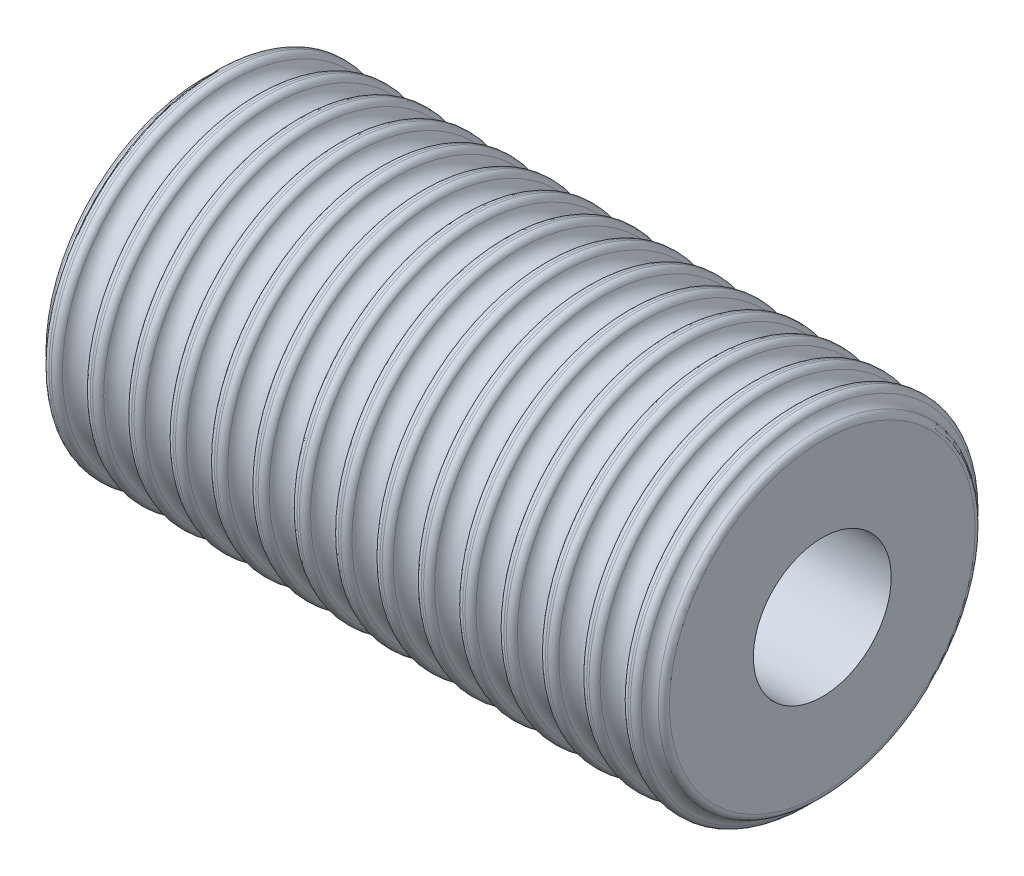
from build123d import *
from build123d.topology import SkipClean

# Parameters (mm, degrees)
SKETCH1_R           = 12.5
SKETCH1_R_2         = 5
BOSS_EXTRUDE1_DEPTH = 22.5
SKETCH11_R          = 1
SKETCH11_5_R        = 1
LPATTERN2_COUNT     = 16
LPATTERN2_PITCH     = 3
FILLET2_R           = 0.5


# Read off the part's stored shape, not the designer's step: LPattern1
with BuildPart() as part:
    # Sketch1 → Boss-Extrude1 (new, symmetric)
    with BuildSketch(Plane.YZ):
        with Locations(Location((0, 0, 0), (0, 0, 90))):
            Circle(SKETCH1_R)
        with Locations(Location((0, 0, 0), (0, 0, 90))):
            Circle(SKETCH1_R_2, mode=Mode.SUBTRACT)
    extrude(amount=BOSS_EXTRUDE1_DEPTH, both=True)

    # Sketch11 → Cut-Revolve1 (revolve, cut)
    with BuildSketch(Plane(origin=(0, 0, 0), x_dir=(-1, 0, 0), z_dir=(0, 1, 0))):
        with Locations((-22.5, 12.5)):
            Circle(SKETCH11_R)
    revolve(axis=Axis((25.114184058, 0, 0), (-1, 0, 0)), mode=Mode.SUBTRACT)

    # LPattern1 outline → LPattern1 (revolve, cut)
    with BuildSketch(Plane.YX):
        with BuildLine():
            Line((12.5, 19.5), (11.5, 19.5))
            ThreePointArc((11.5, 19.5), (11.792893219, 18.792893219), (12.5, 18.5))
            Line((12.5, 18.5), (12.5, 19.5))
        make_face()
        with BuildLine():
            Line((12.5, 15.5), (12.5, 16.5))
            Line((12.5, 16.5), (11.5, 16.5))
            ThreePointArc((11.5, 16.5), (11.792893219, 15.792893219), (12.5, 15.5))
        make_face()
        with BuildLine():
            Line((12.5, 12.5), (12.5, 13.5))
            Line((12.5, 13.5), (11.5, 13.5))
            ThreePointArc((11.5, 13.5), (11.792893219, 12.792893219), (12.5, 12.5))
        make_face()
        with BuildLine():
            Line((12.5, 9.5), (12.5, 10.5))
            Line((12.5, 10.5), (11.5, 10.5))
            ThreePointArc((11.5, 10.5), (11.792893219, 9.792893219), (12.5, 9.5))
        make_face()
        with BuildLine():
            Line((12.5, 6.5), (12.5, 7.5))
            Line((12.5, 7.5), (11.5, 7.5))
            ThreePointArc((11.5, 7.5), (11.792893219, 6.792893219), (12.5, 6.5))
        make_face()
        with BuildLine():
            Line((12.5, 3.5), (12.5, 4.5))
            Line((12.5, 4.5), (11.5, 4.5))
            ThreePointArc((11.5, 4.5), (11.792893219, 3.792893219), (12.5, 3.5))
        make_face()
        with BuildLine():
            Line((12.5, 0.5), (12.5, 1.5))
            Line((12.5, 1.5), (11.5, 1.5))
            ThreePointArc((11.5, 1.5), (11.792893219, 0.792893219), (12.5, 0.5))
        make_face()
        with BuildLine():
            Line((12.5, -2.5), (12.5, -1.5))
            Line((12.5, -1.5), (11.5, -1.5))
            ThreePointArc((11.5, -1.5), (11.792893219, -2.207106781), (12.5, -2.5))
        make_face()
        with BuildLine():
            Line((12.5, -5.5), (12.5, -4.5))
            Line((12.5, -4.5), (11.5, -4.5))
            ThreePointArc((11.5, -4.5), (11.792893219, -5.207106781), (12.5, -5.5))
        make_face()
        with BuildLine():
            Line((12.5, -8.5), (12.5, -7.5))
            Line((12.5, -7.5), (11.5, -7.5))
            ThreePointArc((11.5, -7.5), (11.792893219, -8.207106781), (12.5, -8.5))
        make_face()
        with BuildLine():
            Line((12.5, -11.5), (12.5, -10.5))
            Line((12.5, -10.5), (11.5, -10.5))
            ThreePointArc((11.5, -10.5), (11.792893219, -11.207106781), (12.5, -11.5))
        make_face()
        with BuildLine():
            Line((12.5, -14.5), (12.5, -13.5))
            Line((12.5, -13.5), (11.5, -13.5))
            ThreePointArc((11.5, -13.5), (11.792893219, -14.207106781), (12.5, -14.5))
        make_face()
        with BuildLine():
            Line((12.5, -17.5), (12.5, -16.5))
            Line((12.5, -16.5), (11.5, -16.5))
            ThreePointArc((11.5, -16.5), (11.792893219, -17.207106781), (12.5, -17.5))
        make_face()
        with BuildLine():
            Line((12.5, -20.5), (12.5, -19.5))
            Line((12.5, -19.5), (11.5, -19.5))
            ThreePointArc((11.5, -19.5), (11.792893219, -20.207106781), (12.5, -20.5))
        make_face()
    revolve(axis=Axis((0, 0, 0), (1, 0, 0)), mode=Mode.SUBTRACT)

    # Sketch11<5> → Cut-Revolve2 (revolve, cut)
    with BuildSketch(Plane(origin=(0, 0, 0), x_dir=(-1, 0, 0), z_dir=(0, 1, 0)), mode=Mode.PRIVATE) as cut_revolve2_sk:
        with Locations((22.5, 12.5)):
            Circle(SKETCH11_5_R)
    cut_revolve2 = revolve(cut_revolve2_sk.sketch.rotate(Axis((25.114184058, 0, 0), (-1, 0, 0)), 180), axis=Axis((25.114184058, 0, 0), (-1, 0, 0)), mode=Mode.SUBTRACT)

    # LPattern2: Cut-Revolve2 ×16
    with SkipClean():  # the faces are left unmerged after this step: merging them gives an invalid solid
        with Locations(*[(i * LPATTERN2_PITCH, 0, 0) for i in range(1, LPATTERN2_COUNT)]):
            add(cut_revolve2, mode=Mode.SUBTRACT)

    # Fillet2
    fillet2_edges = [part.edges().sort_by_distance(p)[0] for p in [
        (-12.5, 12.5, 0),
        (-9.5, 12.5, 0),
        (22.5, -11.5, 0),
        (-6.5, 12.5, 0),
        (21.5, -12.5, 0),
        (-3.5, 12.5, 0),
        (-0.5, 12.5, 0),
        (2.5, 12.5, 0),
        (5.5, -12.5, 0),
        (8.5, -12.5, 0),
        (11.5, -12.5, 0),
        (14.5, -12.5, 0),
        (17.5, -12.5, 0),
        (20.5, -12.5, 0),
        (18.5, -12.5, 0),
        (15.5, -12.5, 0),
        (12.5, -12.5, 0),
        (9.5, -12.5, 0),
        (6.5, -12.5, 0),
        (3.5, -12.5, 0),
        (0.5, -12.5, 0),
        (-2.5, -12.5, 0),
        (-5.5, -12.5, 0),
        (-8.5, -12.5, 0),
        (-11.5, -12.5, 0),
        (-14.5, -12.5, 0),
        (-17.5, -12.5, 0),
        (-20.5, -12.5, 0),
        (-21.5, -12.5, 0),
        (-22.5, 0, 11.5),
        (-18.5, 12.5, 0),
        (-15.5, 12.5, 0),
    ]]
    fillet(fillet2_edges, radius=FILLET2_R)


solid = part.part
